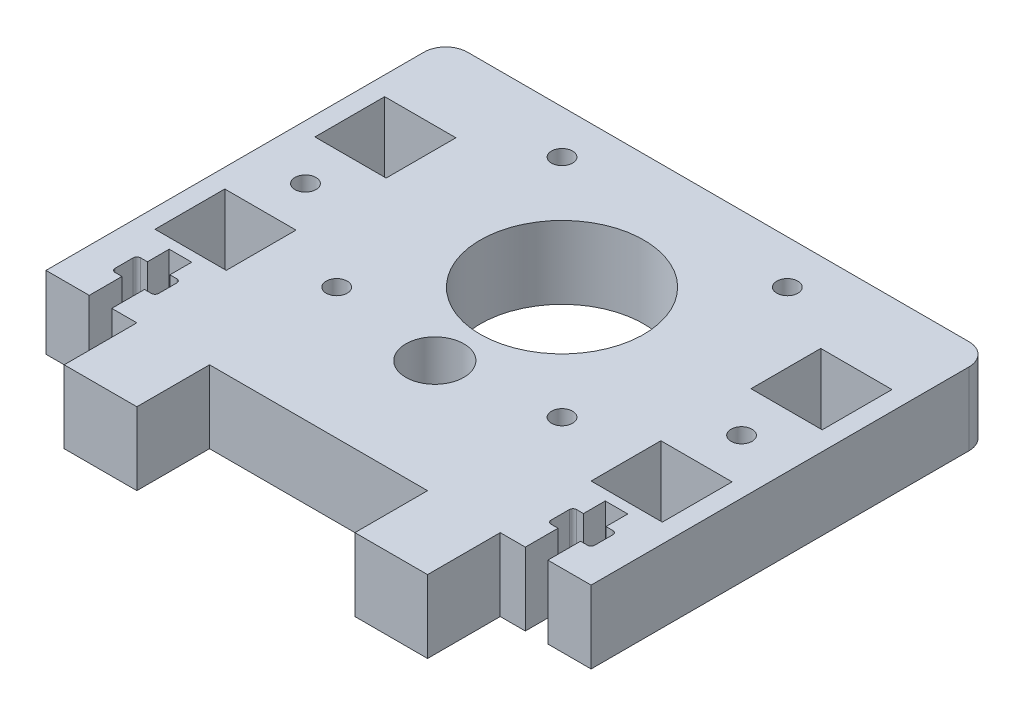
from build123d import *

# Parameters (mm, degrees)
SKETCH1_R        = 1.45
SKETCH1_W        = 9.8
SKETCH1_H        = 9.6
MAINLAYOUT_DEPTH = 10
TSLOT_DEPTH      = 53.936282454


with BuildPart() as part:
    # Sketch1 → MainLayout (new body)
    with BuildSketch(Plane(origin=(0, 0, 0), x_dir=(1, 0, 0), z_dir=(0, 1, 0))):
        with BuildLine():
            Line((-34.5, 29), (0, 29))
            Line((0, 29), (0, 18.75))
            ThreePointArc((0, 18.75), (-11.25, 7.5), (0, -3.75))
            Line((0, -3.75), (0, -6))
            ThreePointArc((0, -6), (-4, -10), (0, -14))
            Line((0, -14), (0, -26))
            Line((0, -26), (-15, -26))
            Line((-15, -26), (-15, -36))
            Line((-15, -36), (-25, -36))
            Line((-25, -36), (-25, -26))
            Line((-25, -26), (-37.5, -26))
            Line((-37.5, -26), (-37.5, 26))
            ThreePointArc((-37.5, 26), (-36.621320344, 28.121320344), (-34.5, 29))
        make_face()
        with Locations((-15.5, 23)):
            Circle(SKETCH1_R, mode=Mode.SUBTRACT)
        with Locations((-15.5, -8)):
            Circle(SKETCH1_R, mode=Mode.SUBTRACT)
        with Locations((-30, 2.2)):
            Circle(SKETCH1_R, mode=Mode.SUBTRACT)
        with Locations((-30, 13.2)):
            Rectangle(SKETCH1_W, SKETCH1_H, mode=Mode.SUBTRACT)
        with Locations((-30, -8.8)):
            Rectangle(SKETCH1_W, SKETCH1_H, mode=Mode.SUBTRACT)
    mainlayout = extrude(amount=MAINLAYOUT_DEPTH)

    # Sketch2 → TSlot (cut, through all)
    with BuildSketch(Plane(origin=(0, 10, 0), x_dir=(1, 0, 0), z_dir=(0, 1, 0))):
        with BuildLine():
            Line((-28.45, -21.5), (-28.45, -26))
            Line((-28.45, -26), (-31.55, -26))
            Line((-31.55, -26), (-31.55, -21.5))
            Line((-31.55, -21.5), (-32.5, -21.5))
            ThreePointArc((-32.5, -21.5), (-32.853553391, -21.353553391), (-33, -21))
            Line((-33, -21), (-33, -18.5))
            ThreePointArc((-33, -18.5), (-32.853553391, -18.146446609), (-32.5, -18))
            Line((-32.5, -18), (-31.55, -18))
            Line((-31.55, -18), (-31.55, -15))
            Line((-31.55, -15), (-28.45, -15))
            Line((-28.45, -15), (-28.45, -18))
            Line((-28.45, -18), (-27.5, -18))
            ThreePointArc((-27.5, -18), (-27.146446609, -18.146446609), (-27, -18.5))
            Line((-27, -18.5), (-27, -21))
            ThreePointArc((-27, -21), (-27.146446609, -21.353553391), (-27.5, -21.5))
            Line((-27.5, -21.5), (-28.45, -21.5))
        make_face()
    tslot = extrude(amount=-TSLOT_DEPTH, mode=Mode.SUBTRACT)

    # Mirror1: MainLayout, TSlot across plane
    add(mainlayout.mirror(Plane(origin=(0, 0, 0), x_dir=(0, 0, 1), z_dir=(1, 0, 0))))
    add(tslot.mirror(Plane(origin=(0, 0, 0), x_dir=(0, 0, 1), z_dir=(1, 0, 0))), mode=Mode.SUBTRACT)


solid = part.part
